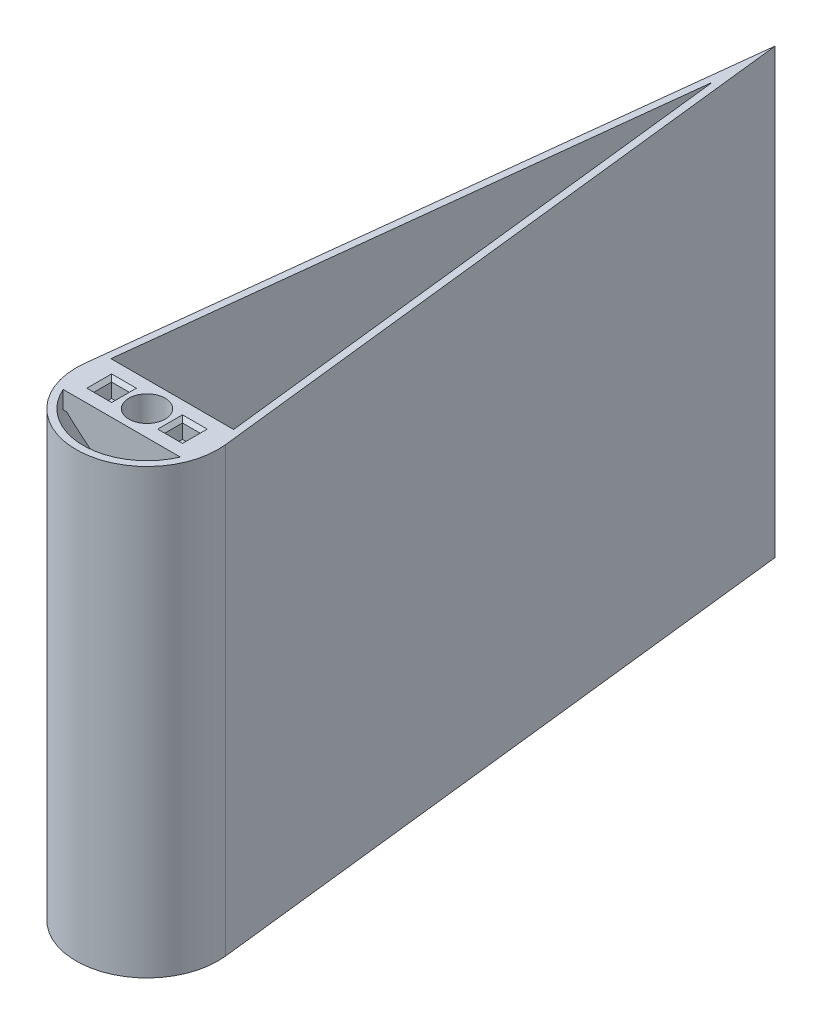
from build123d import *
from build123d.topology import SkipClean

# Parameters (mm, degrees)
SKETCH1_R           = 5.125
BOSS_EXTRUDE1_DEPTH = 125
SKETCH2_W           = 5
SKETCH2_H           = 5
CUT_EXTRUDE1_DEPTH  = 5
SHELL1_START        = 7
SHELL1_OUTLINE_R    = 7.125
SHELL1_DEPTH        = 118
SHELL1_START_2      = 2
SHELL1_2_DEPTH      = 5
FILLET1_R           = 5
BOSS_EXTRUDE2_START = -5
SKETCH3_R           = 5.125
BOSS_EXTRUDE2_DEPTH = 5
CHAMFER1_SIZE       = 10
SKETCH5_W           = 5
SKETCH5_H           = 5
CUT_EXTRUDE3_DEPTH  = 5
CHAMFER2_SIZE       = 1


# Read off the part's stored shape, not the designer's step: Shell1
# Some blends are built 0.0001 mm under size
with BuildPart() as part:
    # Sketch1 → Boss-Extrude1 (new body)
    with BuildSketch(Plane(origin=(0, 0, 0), x_dir=(1, 0, 0), z_dir=(0, 1, 0))):
        with BuildLine():
            Line((-19.872284, 2.256615), (0, 177.256615))
            Line((0, 177.256615), (19.872284, 2.256615))
            ThreePointArc((19.872284, 2.256615), (0, -20), (-19.872284, 2.256615))
        make_face()
        with Locations(Location((0, 0, 0), (0, 0, 270))):
            Circle(SKETCH1_R, mode=Mode.SUBTRACT)
    extrude(amount=BOSS_EXTRUDE1_DEPTH)

    # Sketch2 → Cut-Extrude1 (cut)
    with BuildSketch(Plane.XZ):
        with Locations((10, 0)):
            Rectangle(SKETCH2_W, SKETCH2_H)
        with Locations((0, 10)):
            Rectangle(SKETCH2_W, SKETCH2_H)
        with Locations((0, -10)):
            Rectangle(SKETCH2_W, SKETCH2_H)
        with Locations((-10, 0)):
            Rectangle(SKETCH2_W, SKETCH2_H)
    extrude(amount=-CUT_EXTRUDE1_DEPTH, mode=Mode.SUBTRACT)

    # Shell1 outline → Shell1 (cut)
    with BuildSketch(Plane(origin=(0, 0, 0), x_dir=(1, 0, 0), z_dir=(0, 1, 0)).offset(SHELL1_START)):
        with BuildLine():
            ThreePointArc((-17.885056, 2.030954), (0, -18), (17.885056, 2.030954))
            Line((17.885056, 2.030954), (0, 159.530954))
            Line((0, 159.530954), (-17.885056, 2.030954))
        make_face()
        Circle(SHELL1_OUTLINE_R, mode=Mode.SUBTRACT)
    extrude(amount=SHELL1_DEPTH, mode=Mode.SUBTRACT)

    # Shell1 2 outline → Shell1 2 (cut)
    with SkipClean():  # the faces are left unmerged after this step: merging them gives an invalid solid
        with BuildSketch(Plane(origin=(0, 0, 0), x_dir=(1, 0, 0), z_dir=(0, 1, 0)).offset(SHELL1_START_2)):
            with BuildLine():
                ThreePointArc((-17.885056, 2.030954), (0, -18), (17.885056, 2.030954))
                Line((17.885056, 2.030954), (0, 159.530954))
                Line((0, 159.530954), (-17.885056, 2.030954))
            make_face()
            with BuildLine():
                ThreePointArc((4.5, 5.524095), (5.038136, 5.038136), (5.524095, 4.5))
                Line((5.524095, 4.5), (14.5, 4.5))
                Line((14.5, 4.5), (14.5, -4.5))
                Line((14.5, -4.5), (5.524095, -4.5))
                ThreePointArc((5.524095, -4.5), (5.038136, -5.038136), (4.5, -5.524095))
                Line((4.5, -5.524095), (4.5, -14.5))
                Line((4.5, -14.5), (-4.5, -14.5))
                Line((-4.5, -14.5), (-4.5, -5.524095))
                ThreePointArc((-4.5, -5.524095), (-5.038136, -5.038136), (-5.524095, -4.5))
                Line((-5.524095, -4.5), (-14.5, -4.5))
                Line((-14.5, -4.5), (-14.5, 4.5))
                Line((-14.5, 4.5), (-5.524095, 4.5))
                ThreePointArc((-5.524095, 4.5), (-5.038136, 5.038136), (-4.5, 5.524095))
                Line((-4.5, 5.524095), (-4.5, 14.5))
                Line((-4.5, 14.5), (4.5, 14.5))
                Line((4.5, 14.5), (4.5, 5.524095))
            make_face(mode=Mode.SUBTRACT)
        extrude(amount=SHELL1_2_DEPTH, mode=Mode.SUBTRACT)

    # Fillet1
    fillet1_edges = [part.edges().sort_by_distance(p)[0] for p in [
        (5.038136, 2, 5.038136),
        (-5.038136, 2, 5.038136),
        (-5.038136, 2, -5.038136),
        (5.038136, 2, -5.038136),
    ]]
    fillet(fillet1_edges, radius=FILLET1_R - 0.0001)  # a hair under: the kernel refuses the full size

    # Sketch3 → Boss-Extrude2 (add)
    with SkipClean():  # the faces are left unmerged after this step: merging them gives an invalid solid
        with BuildSketch(Plane(origin=(0, 125, 0), x_dir=(1, 0, 0), z_dir=(0, 1, 0)).offset(BOSS_EXTRUDE2_START)):
            with BuildLine():
                Line((-16.529803, -7.125), (16.529803, -7.125))
                ThreePointArc((16.529803, -7.125), (17.805996, -2.635622), (17.885056, 2.030954))
                Line((17.885056, 2.030954), (17.306597, 7.125))
                Line((17.306597, 7.125), (-17.306597, 7.125))
                Line((-17.306597, 7.125), (-17.885056, 2.030954))
                ThreePointArc((-17.885056, 2.030954), (-17.805996, -2.635622), (-16.529803, -7.125))
            make_face()
            with Locations(Location((0, 0, 0), (0, 0, 270))):
                Circle(SKETCH3_R, mode=Mode.SUBTRACT)
        extrude(amount=BOSS_EXTRUDE2_DEPTH)

    # Chamfer1
    # the kernel refuses this chamfer: 10 mm, written as the material it adds along each edge
    with BuildSketch(Plane(origin=(0, 120, 0), x_dir=(1, 0, 0), z_dir=(0, 0, -1))) as chamfer1_piece_1_section:
        Polygon((7.125 + CHAMFER1_SIZE, 0), (7.125, CHAMFER1_SIZE), (7.125, 0), align=None)
    chamfer1_piece_1 = revolve(axis=Axis((0, 120, 0), (0, -1, 0)), revolution_arc=90, mode=Mode.PRIVATE)
    chamfer1_piece_1 = split(chamfer1_piece_1, bisect_by=Plane(origin=(9.148116, 116.581472, 7.125), z_dir=(0, 0, -1)), keep=Keep.TOP, mode=Mode.PRIVATE)
    add(chamfer1_piece_1)
    with BuildSketch(Plane(origin=(0, 120, 0), x_dir=(0, 0, 1), z_dir=(1, 0, 0))) as chamfer1_piece_2_section:
        Polygon((7.125 + CHAMFER1_SIZE, 0), (7.125, CHAMFER1_SIZE), (7.125, 0), align=None)
    chamfer1_piece_2 = revolve(axis=Axis((0, 120, 0), (0, -1, 0)), revolution_arc=180, mode=Mode.PRIVATE)
    chamfer1_piece_2 = split(chamfer1_piece_2, bisect_by=Plane(origin=(-9.148116, 116.581472, 7.125), z_dir=(0, 0, -1)), keep=Keep.TOP, mode=Mode.PRIVATE)
    chamfer1_piece_2 = split(chamfer1_piece_2, bisect_by=Plane(origin=(-9.148116, 116.581472, -7.125), z_dir=(0, 0, 1)), keep=Keep.TOP, mode=Mode.PRIVATE)
    add(chamfer1_piece_2)
    with BuildSketch(Plane(origin=(0, 120, 0), x_dir=(0, 0, -1), z_dir=(-1, 0, 0))) as chamfer1_piece_3_section:
        Polygon((7.125 + CHAMFER1_SIZE, 0), (7.125, CHAMFER1_SIZE), (7.125, 0), align=None)
    chamfer1_piece_3 = revolve(axis=Axis((0, 120, 0), (0, -1, 0)), revolution_arc=90, mode=Mode.PRIVATE)
    chamfer1_piece_3 = split(chamfer1_piece_3, bisect_by=Plane(origin=(9.148116, 116.581472, -7.125), z_dir=(0, 0, 1)), keep=Keep.TOP, mode=Mode.PRIVATE)
    add(chamfer1_piece_3)

    # Sketch5 → Cut-Extrude3 (cut)
    with BuildSketch(Plane(origin=(0, 125, 0), x_dir=(1, 0, 0), z_dir=(0, 1, 0))):
        with Locations((10, 0)):
            Rectangle(SKETCH5_W, SKETCH5_H)
        with Locations((-10, 0)):
            Rectangle(SKETCH5_W, SKETCH5_H)
    extrude(amount=-CUT_EXTRUDE3_DEPTH, mode=Mode.SUBTRACT)

    # Chamfer2
    # the kernel refuses this chamfer: 1 mm, written as the material it takes off along each edge
    with BuildSketch(Plane(origin=(-7.5, 125, -2.5), x_dir=(0.999621916911297, 0.027495876610582174, 0), z_dir=(0, 0, 1)), Plane(origin=(-12.5, 125, -2.5), x_dir=(0, 0.02749587661058217, -0.9996219169112968), z_dir=(1, 0, 0)), Plane(origin=(-12.5, 125, 2.5), x_dir=(-0.999621916911297, 0.0274958766105822, 0), z_dir=(0, 0, -1)), Plane(origin=(-7.5, 125, 2.5), x_dir=(0, 0.02749587661058217, 0.9996219169112968), z_dir=(-1, 0, 0))) as chamfer2_piece_1:
        Polygon((CHAMFER2_SIZE * 0.999621916911, -CHAMFER2_SIZE * 0.0274958766106), (-CHAMFER2_SIZE * 0.0274958766106, -CHAMFER2_SIZE * 0.999621916911), (0, 0), align=None)
    extrude(amount=5, mode=Mode.SUBTRACT)
    with BuildSketch(Plane(origin=(12.5, 125, -2.5), x_dir=(0, 0.02749587661058217, -0.9996219169112968), z_dir=(-1, 0, 0)), Plane(origin=(7.5, 125, -2.5), x_dir=(-0.999621916911297, 0.027495876610582174, 0), z_dir=(0, 0, 1)), Plane(origin=(7.5, 125, 2.5), x_dir=(0, 0.02749587661058217, 0.9996219169112968), z_dir=(1, 0, 0)), Plane(origin=(12.5, 125, 2.5), x_dir=(0.999621916911297, 0.0274958766105822, 0), z_dir=(0, 0, -1))) as chamfer2_piece_2:
        Polygon((CHAMFER2_SIZE * 0.999621916911, CHAMFER2_SIZE * 0.0274958766106), (-CHAMFER2_SIZE * 0.0274958766106, CHAMFER2_SIZE * 0.999621916911), (0, 0), align=None)
    extrude(amount=5, mode=Mode.SUBTRACT)
    with BuildSketch(Plane(origin=(-7.5, 125, -5.071683), x_dir=(0.999621916911297, 0.027495876610582174, 0), z_dir=(0, 0, 1))) as chamfer2_piece_3a_section:
        Polygon((CHAMFER2_SIZE * 0.999621916911, -CHAMFER2_SIZE * 0.0274958766106), (-CHAMFER2_SIZE * 0.0274958766106, -CHAMFER2_SIZE * 0.999621916911), (0, 0), align=None)
    chamfer2_piece_3a = extrude(amount=7.571683, mode=Mode.PRIVATE)
    chamfer2_piece_3a = split(chamfer2_piece_3a, bisect_by=Plane(origin=(-7.170206, 124.670206, -2.5), z_dir=(0, 0, -1)), keep=Keep.TOP, mode=Mode.PRIVATE)
    with BuildSketch(Plane(origin=(-12.5, 125, -2.5), x_dir=(0, 0.02749587661058217, -0.9996219169112968), z_dir=(1, 0, 0))) as chamfer2_piece_3b_section:
        Polygon((CHAMFER2_SIZE * 0.999621916911, -CHAMFER2_SIZE * 0.0274958766106), (-CHAMFER2_SIZE * 0.0274958766106, -CHAMFER2_SIZE * 0.999621916911), (0, 0), align=None)
    chamfer2_piece_3b = extrude(amount=7.571683, mode=Mode.PRIVATE)
    chamfer2_piece_3b = split(chamfer2_piece_3b, bisect_by=Plane(origin=(-7.5, 124.670206, -2.829794), z_dir=(1, 0, 0)), keep=Keep.TOP, mode=Mode.PRIVATE)
    chamfer2_piece_3 = chamfer2_piece_3a & chamfer2_piece_3b
    add(chamfer2_piece_3, mode=Mode.SUBTRACT)
    with BuildSketch(Plane(origin=(-4.928317, 125, 2.5), x_dir=(0, 0.02749587661058217, 0.9996219169112968), z_dir=(-1, 0, 0))) as chamfer2_piece_4a_section:
        Polygon((CHAMFER2_SIZE * 0.999621916911, -CHAMFER2_SIZE * 0.0274958766106), (-CHAMFER2_SIZE * 0.0274958766106, -CHAMFER2_SIZE * 0.999621916911), (0, 0), align=None)
    chamfer2_piece_4a = extrude(amount=7.571683, mode=Mode.PRIVATE)
    chamfer2_piece_4a = split(chamfer2_piece_4a, bisect_by=Plane(origin=(-7.5, 124.670206, 2.829794), z_dir=(1, 0, 0)), keep=Keep.TOP, mode=Mode.PRIVATE)
    with BuildSketch(Plane(origin=(-7.5, 125, -2.5), x_dir=(0.999621916911297, 0.027495876610582174, 0), z_dir=(0, 0, 1))) as chamfer2_piece_4b_section:
        Polygon((CHAMFER2_SIZE * 0.999621916911, -CHAMFER2_SIZE * 0.0274958766106), (-CHAMFER2_SIZE * 0.0274958766106, -CHAMFER2_SIZE * 0.999621916911), (0, 0), align=None)
    chamfer2_piece_4b = extrude(amount=7.571683, mode=Mode.PRIVATE)
    chamfer2_piece_4b = split(chamfer2_piece_4b, bisect_by=Plane(origin=(-7.170206, 124.670206, 2.5), z_dir=(0, 0, 1)), keep=Keep.TOP, mode=Mode.PRIVATE)
    chamfer2_piece_4 = chamfer2_piece_4a & chamfer2_piece_4b
    add(chamfer2_piece_4, mode=Mode.SUBTRACT)
    with BuildSketch(Plane(origin=(-12.5, 125, 2.5), x_dir=(-0.999621916911297, 0.0274958766105822, 0), z_dir=(0, 0, -1))) as chamfer2_piece_5a_section:
        Polygon((CHAMFER2_SIZE * 0.999621916911, -CHAMFER2_SIZE * 0.0274958766106), (-CHAMFER2_SIZE * 0.0274958766106, -CHAMFER2_SIZE * 0.999621916911), (0, 0), align=None)
    chamfer2_piece_5a = extrude(amount=7.571683, mode=Mode.PRIVATE)
    chamfer2_piece_5a = split(chamfer2_piece_5a, bisect_by=Plane(origin=(-12.829794, 124.670206, -2.5), z_dir=(0, 0, -1)), keep=Keep.TOP, mode=Mode.PRIVATE)
    with BuildSketch(Plane(origin=(-15.071683, 125, -2.5), x_dir=(0, 0.02749587661058217, -0.9996219169112968), z_dir=(1, 0, 0))) as chamfer2_piece_5b_section:
        Polygon((CHAMFER2_SIZE * 0.999621916911, -CHAMFER2_SIZE * 0.0274958766106), (-CHAMFER2_SIZE * 0.0274958766106, -CHAMFER2_SIZE * 0.999621916911), (0, 0), align=None)
    chamfer2_piece_5b = extrude(amount=7.571683, mode=Mode.PRIVATE)
    chamfer2_piece_5b = split(chamfer2_piece_5b, bisect_by=Plane(origin=(-12.5, 124.670206, -2.829794), z_dir=(-1, 0, 0)), keep=Keep.TOP, mode=Mode.PRIVATE)
    chamfer2_piece_5 = chamfer2_piece_5a & chamfer2_piece_5b
    add(chamfer2_piece_5, mode=Mode.SUBTRACT)
    with BuildSketch(Plane(origin=(-12.5, 125, 5.071683), x_dir=(-0.999621916911297, 0.0274958766105822, 0), z_dir=(0, 0, -1))) as chamfer2_piece_6a_section:
        Polygon((CHAMFER2_SIZE * 0.999621916911, -CHAMFER2_SIZE * 0.0274958766106), (-CHAMFER2_SIZE * 0.0274958766106, -CHAMFER2_SIZE * 0.999621916911), (0, 0), align=None)
    chamfer2_piece_6a = extrude(amount=7.571683, mode=Mode.PRIVATE)
    chamfer2_piece_6a = split(chamfer2_piece_6a, bisect_by=Plane(origin=(-12.829794, 124.670206, 2.5), z_dir=(0, 0, 1)), keep=Keep.TOP, mode=Mode.PRIVATE)
    with BuildSketch(Plane(origin=(-7.5, 125, 2.5), x_dir=(0, 0.02749587661058217, 0.9996219169112968), z_dir=(-1, 0, 0))) as chamfer2_piece_6b_section:
        Polygon((CHAMFER2_SIZE * 0.999621916911, -CHAMFER2_SIZE * 0.0274958766106), (-CHAMFER2_SIZE * 0.0274958766106, -CHAMFER2_SIZE * 0.999621916911), (0, 0), align=None)
    chamfer2_piece_6b = extrude(amount=7.571683, mode=Mode.PRIVATE)
    chamfer2_piece_6b = split(chamfer2_piece_6b, bisect_by=Plane(origin=(-12.5, 124.670206, 2.829794), z_dir=(-1, 0, 0)), keep=Keep.TOP, mode=Mode.PRIVATE)
    chamfer2_piece_6 = chamfer2_piece_6a & chamfer2_piece_6b
    add(chamfer2_piece_6, mode=Mode.SUBTRACT)
    with BuildSketch(Plane(origin=(12.5, 125, 2.5), x_dir=(0.999621916911297, 0.0274958766105822, 0), z_dir=(0, 0, -1))) as chamfer2_piece_7a_section:
        Polygon((CHAMFER2_SIZE * 0.999621916911, CHAMFER2_SIZE * 0.0274958766106), (-CHAMFER2_SIZE * 0.0274958766106, CHAMFER2_SIZE * 0.999621916911), (0, 0), align=None)
    chamfer2_piece_7a = extrude(amount=7.571683, mode=Mode.PRIVATE)
    chamfer2_piece_7a = split(chamfer2_piece_7a, bisect_by=Plane(origin=(12.829794, 124.670206, -2.5), z_dir=(0, 0, -1)), keep=Keep.TOP, mode=Mode.PRIVATE)
    with BuildSketch(Plane(origin=(15.071683, 125, -2.5), x_dir=(0, 0.02749587661058217, -0.9996219169112968), z_dir=(-1, 0, 0))) as chamfer2_piece_7b_section:
        Polygon((CHAMFER2_SIZE * 0.999621916911, CHAMFER2_SIZE * 0.0274958766106), (-CHAMFER2_SIZE * 0.0274958766106, CHAMFER2_SIZE * 0.999621916911), (0, 0), align=None)
    chamfer2_piece_7b = extrude(amount=7.571683, mode=Mode.PRIVATE)
    chamfer2_piece_7b = split(chamfer2_piece_7b, bisect_by=Plane(origin=(12.5, 124.670206, -2.829794), z_dir=(1, 0, 0)), keep=Keep.TOP, mode=Mode.PRIVATE)
    chamfer2_piece_7 = chamfer2_piece_7a & chamfer2_piece_7b
    add(chamfer2_piece_7, mode=Mode.SUBTRACT)
    with BuildSketch(Plane(origin=(12.5, 125, -2.5), x_dir=(0, 0.02749587661058217, -0.9996219169112968), z_dir=(-1, 0, 0))) as chamfer2_piece_8a_section:
        Polygon((CHAMFER2_SIZE * 0.999621916911, CHAMFER2_SIZE * 0.0274958766106), (-CHAMFER2_SIZE * 0.0274958766106, CHAMFER2_SIZE * 0.999621916911), (0, 0), align=None)
    chamfer2_piece_8a = extrude(amount=7.571683, mode=Mode.PRIVATE)
    chamfer2_piece_8a = split(chamfer2_piece_8a, bisect_by=Plane(origin=(7.5, 124.670206, -2.829794), z_dir=(-1, 0, 0)), keep=Keep.TOP, mode=Mode.PRIVATE)
    with BuildSketch(Plane(origin=(7.5, 125, -5.071683), x_dir=(-0.999621916911297, 0.027495876610582174, 0), z_dir=(0, 0, 1))) as chamfer2_piece_8b_section:
        Polygon((CHAMFER2_SIZE * 0.999621916911, CHAMFER2_SIZE * 0.0274958766106), (-CHAMFER2_SIZE * 0.0274958766106, CHAMFER2_SIZE * 0.999621916911), (0, 0), align=None)
    chamfer2_piece_8b = extrude(amount=7.571683, mode=Mode.PRIVATE)
    chamfer2_piece_8b = split(chamfer2_piece_8b, bisect_by=Plane(origin=(7.170206, 124.670206, -2.5), z_dir=(0, 0, -1)), keep=Keep.TOP, mode=Mode.PRIVATE)
    chamfer2_piece_8 = chamfer2_piece_8a & chamfer2_piece_8b
    add(chamfer2_piece_8, mode=Mode.SUBTRACT)
    with BuildSketch(Plane(origin=(7.5, 125, -2.5), x_dir=(-0.999621916911297, 0.027495876610582174, 0), z_dir=(0, 0, 1))) as chamfer2_piece_9a_section:
        Polygon((CHAMFER2_SIZE * 0.999621916911, CHAMFER2_SIZE * 0.0274958766106), (-CHAMFER2_SIZE * 0.0274958766106, CHAMFER2_SIZE * 0.999621916911), (0, 0), align=None)
    chamfer2_piece_9a = extrude(amount=7.571683, mode=Mode.PRIVATE)
    chamfer2_piece_9a = split(chamfer2_piece_9a, bisect_by=Plane(origin=(7.170206, 124.670206, 2.5), z_dir=(0, 0, 1)), keep=Keep.TOP, mode=Mode.PRIVATE)
    with BuildSketch(Plane(origin=(4.928317, 125, 2.5), x_dir=(0, 0.02749587661058217, 0.9996219169112968), z_dir=(1, 0, 0))) as chamfer2_piece_9b_section:
        Polygon((CHAMFER2_SIZE * 0.999621916911, CHAMFER2_SIZE * 0.0274958766106), (-CHAMFER2_SIZE * 0.0274958766106, CHAMFER2_SIZE * 0.999621916911), (0, 0), align=None)
    chamfer2_piece_9b = extrude(amount=7.571683, mode=Mode.PRIVATE)
    chamfer2_piece_9b = split(chamfer2_piece_9b, bisect_by=Plane(origin=(7.5, 124.670206, 2.829794), z_dir=(-1, 0, 0)), keep=Keep.TOP, mode=Mode.PRIVATE)
    chamfer2_piece_9 = chamfer2_piece_9a & chamfer2_piece_9b
    add(chamfer2_piece_9, mode=Mode.SUBTRACT)
    with BuildSketch(Plane(origin=(12.5, 125, 5.071683), x_dir=(0.999621916911297, 0.0274958766105822, 0), z_dir=(0, 0, -1))) as chamfer2_piece_10a_section:
        Polygon((CHAMFER2_SIZE * 0.999621916911, CHAMFER2_SIZE * 0.0274958766106), (-CHAMFER2_SIZE * 0.0274958766106, CHAMFER2_SIZE * 0.999621916911), (0, 0), align=None)
    chamfer2_piece_10a = extrude(amount=7.571683, mode=Mode.PRIVATE)
    chamfer2_piece_10a = split(chamfer2_piece_10a, bisect_by=Plane(origin=(12.829794, 124.670206, 2.5), z_dir=(0, 0, 1)), keep=Keep.TOP, mode=Mode.PRIVATE)
    with BuildSketch(Plane(origin=(7.5, 125, 2.5), x_dir=(0, 0.02749587661058217, 0.9996219169112968), z_dir=(1, 0, 0))) as chamfer2_piece_10b_section:
        Polygon((CHAMFER2_SIZE * 0.999621916911, CHAMFER2_SIZE * 0.0274958766106), (-CHAMFER2_SIZE * 0.0274958766106, CHAMFER2_SIZE * 0.999621916911), (0, 0), align=None)
    chamfer2_piece_10b = extrude(amount=7.571683, mode=Mode.PRIVATE)
    chamfer2_piece_10b = split(chamfer2_piece_10b, bisect_by=Plane(origin=(12.5, 124.670206, 2.829794), z_dir=(1, 0, 0)), keep=Keep.TOP, mode=Mode.PRIVATE)
    chamfer2_piece_10 = chamfer2_piece_10a & chamfer2_piece_10b
    add(chamfer2_piece_10, mode=Mode.SUBTRACT)


solid = part.part
